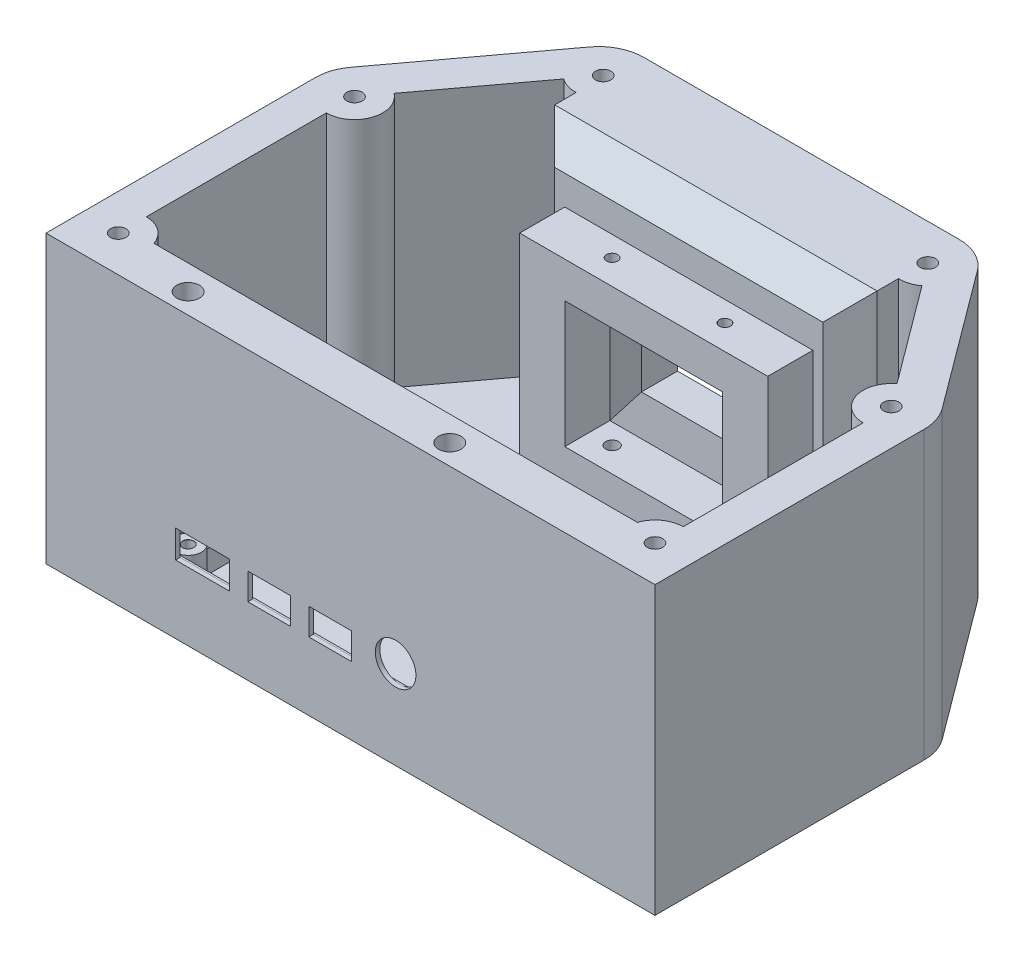
from build123d import *

# Parameters (mm, degrees)
BOSS_EXTRUDE1_DEPTH                                = 7
BOSS_EXTRUDE2_DEPTH                                = 5
SKETCH2_3_R                                        = 3
BOSS_EXTRUDE3_DEPTH                                = 8
F_2_5MM_DOWEL_HOLE1_D                              = 2.5
F_2_5MM_DOWEL_HOLE1_DEPTH                          = 8
F_2_5MM_DOWEL_HOLE1_CSINK_D                        = 2.55
F_2_5MM_DOWEL_HOLE1_CSINK_ANGLE                    = 90
F_2_5MM_DOWEL_HOLE1_TIP                            = 0.751075774
SKETCH2_4_W                                        = 55
SKETCH2_4_H                                        = 10
BOSS_EXTRUDE4_DEPTH                                = 8
SKETCH7_W                                          = 10
SKETCH7_H                                          = 10
BOSS_EXTRUDE5_DEPTH                                = 28
SKETCH9_W                                          = 55
SKETCH9_H                                          = 10
BOSS_EXTRUDE6_DEPTH                                = 8
SKETCH10_W                                         = 12.5
SKETCH10_H                                         = 44
BOSS_EXTRUDE7_DEPTH                                = 8
BOSS_EXTRUDE10_DEPTH                               = 56.5
FILLET8_R                                          = 10
F_2_5MM_DOWEL_HOLE2_D                              = 2.5
F_2_5MM_DOWEL_HOLE2_DEPTH                          = 8
CBORE_FOR_M2_5_HEX_HEAD_MACHINE_SCREW1_D           = 2.9
CBORE_FOR_M2_5_HEX_HEAD_MACHINE_SCREW1_DEPTH       = 15
CBORE_FOR_M2_5_HEX_HEAD_MACHINE_SCREW1_CBORE_D     = 7.28
CBORE_FOR_M2_5_HEX_HEAD_MACHINE_SCREW1_CBORE_DEPTH = 12
BOSS_EXTRUDE11_REACH                               = 166.956
BOSS_EXTRUDE12_DEPTH                               = 20
SKETCH28_W                                         = 119
SKETCH28_H                                         = 10
BOSS_EXTRUDE13_DEPTH                               = 28.5
CUT_EXTRUDE1_REACH                                 = 185.246
SKETCH16_R                                         = 4.5
SKETCH16_W                                         = 11.94
SKETCH16_H                                         = 6.16
SKETCH16_W_2                                       = 9.5
SKETCH16_H_2                                       = 5.9
CHAMFER1_SIZE                                      = 9
CUT_EXTRUDE2_REACH                                 = 169.482
SKETCH29_R                                         = 2.5
BOSS_EXTRUDE16_REACH                               = 169.482
SKETCH30_R                                         = 6.25
SKETCH30_R_2                                       = 4.25
SKETCH50_W                                         = 6
SKETCH50_H                                         = 56.5
SKETCH50_W_2                                       = 55
SKETCH50_H_2                                       = 44
BOSS_EXTRUDE32_DEPTH                               = 17
SKETCH30_6_R                                       = 4.25
CUT_EXTRUDE3_DEPTH                                 = 57.5
CBORE_FOR_M3_HEX_HEAD_MACHINE_SCREW1_D             = 3.4
CBORE_FOR_M3_HEX_HEAD_MACHINE_SCREW1_CBORE_D       = 8.4
CBORE_FOR_M3_HEX_HEAD_MACHINE_SCREW1_CBORE_DEPTH   = 2.3
CHAMFER5_SIZE                                      = 6


with BuildPart() as part:
    # Sketch1 → Boss-Extrude1 (new body)
    with BuildSketch(Plane(origin=(0, 0, 0), x_dir=(1, 0, 0), z_dir=(0, 1, 0))):
        Polygon((-139.809882217, -3.867603768), (-112.309882217, 33.132396232), (-32.309882217, 33.132396232), (-4.809882217, -3.867603768), (-4.809882217, -66.867603768), (-139.809882217, -66.867603768), align=None)
    extrude(amount=BOSS_EXTRUDE1_DEPTH)

    # Sketch2 → Boss-Extrude2 (add)
    with BuildSketch(Plane(origin=(0, 7, 0), x_dir=(1, 0, 0), z_dir=(0, 1, 0))):
        with BuildLine():
            Line((-115.809882217, -13.367603768), (-115.809882217, -62.367603768))
            ThreePointArc((-115.809882217, -62.367603768), (-114.931202561, -60.246283425), (-112.809882217, -59.367603768))
            Line((-112.809882217, -59.367603768), (-112.809882217, -16.367603768))
            ThreePointArc((-112.809882217, -16.367603768), (-114.931202561, -15.488924112), (-115.809882217, -13.367603768))
        make_face()
        with BuildLine():
            Line((-54.809882217, -10.367603768), (-112.809882217, -10.367603768))
            ThreePointArc((-112.809882217, -10.367603768), (-110.688561874, -11.246283425), (-109.809882217, -13.367603768))
            Line((-109.809882217, -13.367603768), (-57.809882217, -13.367603768))
            ThreePointArc((-57.809882217, -13.367603768), (-56.931202561, -11.246283425), (-54.809882217, -10.367603768))
        make_face()
        with BuildLine():
            ThreePointArc((-109.809882217, -62.367603768), (-110.688561874, -64.488924112), (-112.809882217, -65.367603768))
            Line((-112.809882217, -65.367603768), (-54.809882217, -65.367603768))
            ThreePointArc((-54.809882217, -65.367603768), (-56.931202561, -64.488924112), (-57.809882217, -62.367603768))
            Line((-57.809882217, -62.367603768), (-109.809882217, -62.367603768))
        make_face()
        with BuildLine():
            ThreePointArc((-54.809882217, -59.367603768), (-52.688561874, -60.246283425), (-51.809882217, -62.367603768))
            Line((-51.809882217, -62.367603768), (-51.809882217, -13.367603768))
            ThreePointArc((-51.809882217, -13.367603768), (-52.688561874, -15.488924112), (-54.809882217, -16.367603768))
            Line((-54.809882217, -16.367603768), (-54.809882217, -59.367603768))
        make_face()
    extrude(amount=BOSS_EXTRUDE2_DEPTH)

    # Sketch2<3> → Boss-Extrude3 (add)
    with BuildSketch(Plane(origin=(0, 7, 0), x_dir=(1, 0, 0), z_dir=(0, 1, 0))):
        with Locations(Location((-112.809882217, -13.367603768, 0), (0, 0, 270))):
            Circle(SKETCH2_3_R)
        with Locations(Location((-54.809882217, -13.367603768, 0), (0, 0, 270))):
            Circle(SKETCH2_3_R)
        with Locations(Location((-54.809882217, -62.367603768, 0), (0, 0, 270))):
            Circle(SKETCH2_3_R)
        with Locations(Location((-112.809882217, -62.367603768, 0), (0, 0, 270))):
            Circle(SKETCH2_3_R)
    extrude(amount=BOSS_EXTRUDE3_DEPTH)

    # Ø2.5mm Dowel Hole1
    with Locations(Plane(origin=(0, 15, 0), x_dir=(1, 0, 0), z_dir=(0, 1, 0))):
        with Locations((-54.809882217, -13.367603768), (-112.809882217, -13.367603768), (-54.809882217, -62.367603768), (-112.809882217, -62.367603768)):
            CounterSinkHole(F_2_5MM_DOWEL_HOLE1_D / 2, F_2_5MM_DOWEL_HOLE1_CSINK_D / 2, depth=F_2_5MM_DOWEL_HOLE1_DEPTH, counter_sink_angle=F_2_5MM_DOWEL_HOLE1_CSINK_ANGLE)
            with Locations((0, 0, -(F_2_5MM_DOWEL_HOLE1_DEPTH + F_2_5MM_DOWEL_HOLE1_TIP / 2))):  # 118° drill point
                Cone(0, F_2_5MM_DOWEL_HOLE1_D / 2, F_2_5MM_DOWEL_HOLE1_TIP, mode=Mode.SUBTRACT)

    # Sketch2<4> → Boss-Extrude4 (add)
    with BuildSketch(Plane(origin=(0, 7, 0), x_dir=(1, 0, 0), z_dir=(0, 1, 0))):
        with Locations((-72.309882217, 3.132396232)):
            Rectangle(SKETCH2_4_W, SKETCH2_4_H)
    extrude(amount=BOSS_EXTRUDE4_DEPTH)

    # Sketch7 → Boss-Extrude5 (add)
    with BuildSketch(Plane(origin=(0, 15, 0), x_dir=(1, 0, 0), z_dir=(0, 1, 0))):
        with Locations((-94.809882217, 3.132396232)):
            Rectangle(SKETCH7_W, SKETCH7_H)
        with Locations((-49.809882217, 3.132396232)):
            Rectangle(SKETCH7_W, SKETCH7_H)
    extrude(amount=BOSS_EXTRUDE5_DEPTH)

    # Sketch9 → Boss-Extrude6 (add)
    with BuildSketch(Plane(origin=(0, 43, 0), x_dir=(1, 0, 0), z_dir=(0, 1, 0))):
        with Locations((-72.309882217, 3.132396232)):
            Rectangle(SKETCH9_W, SKETCH9_H)
    extrude(amount=BOSS_EXTRUDE6_DEPTH)

    # Sketch10 → Boss-Extrude7 (add)
    with BuildSketch(Plane(origin=(0, 0, -33.132396232), x_dir=(-1, 0, 0), z_dir=(0, 0, -1))):
        with Locations((38.559882217, 29)):
            Rectangle(SKETCH10_W, SKETCH10_H)
        Polygon((32.309882217, 63.5), (32.309882217, 51), (44.809882217, 51), (99.809882217, 51), (112.309882217, 51), (112.309882217, 63.5), align=None)
        with Locations((106.059882217, 29)):
            Rectangle(SKETCH10_W, SKETCH10_H)
    extrude(amount=-BOSS_EXTRUDE7_DEPTH)

    # Sketch11 → Boss-Extrude10 (add)
    with BuildSketch(Plane(origin=(0, 7, 0), x_dir=(1, 0, 0), z_dir=(0, 1, 0))):
        Polygon((-139.809882217, -66.867603768), (-131.809882217, -66.867603768), (-131.809882217, -65.367603768), (-131.809882217, -58.867603768), (-131.809882217, -6.515002703), (-108.288166793, 25.132396232), (-112.309882217, 25.132396232), (-112.309882217, 33.132396232), (-139.809882217, -3.867603768), align=None)
        Polygon((-4.809882217, -66.867603768), (-12.809882217, -66.867603768), (-12.809882217, -6.515002703), (-36.331597642, 25.132396232), (-36.331597642, 33.132396232), (-32.309882217, 33.132396232), (-4.809882217, -3.867603768), align=None)
    extrude(amount=BOSS_EXTRUDE10_DEPTH)

    # Fillet8
    fillet8_edges = [part.edges().sort_by_distance(p)[0] for p in [
        (-139.809882217, 31.75, 3.867603768),
        (-112.309882217, 31.75, -33.132396232),
        (-32.309882217, 31.75, -33.132396232),
        (-4.809882217, 31.75, 3.867603768),
    ]]
    fillet(fillet8_edges, radius=FILLET8_R)

    # Ø2.5mm Dowel Hole2
    with Locations(Plane(origin=(0, 51, 0), x_dir=(1, 0, 0), z_dir=(0, 1, 0))):
        with Locations((-84.809882217, 3.632396232), (-59.809882217, 3.632396232)):
            Hole(F_2_5MM_DOWEL_HOLE2_D / 2, depth=F_2_5MM_DOWEL_HOLE2_DEPTH)

    # CBORE for M2.5 Hex Head Machine Screw1
    with Locations(Plane(origin=(0, 0, 0), x_dir=(-1, 0, 0), z_dir=(0, -1, 0))):
        with Locations((59.809882217, 3.632396232), (84.809882217, 3.632396232)):
            CounterBoreHole(CBORE_FOR_M2_5_HEX_HEAD_MACHINE_SCREW1_D / 2, CBORE_FOR_M2_5_HEX_HEAD_MACHINE_SCREW1_CBORE_D / 2, CBORE_FOR_M2_5_HEX_HEAD_MACHINE_SCREW1_CBORE_DEPTH, depth=CBORE_FOR_M2_5_HEX_HEAD_MACHINE_SCREW1_DEPTH)

    # Boss-Extrude11: up to this face of the body (flat: up to its plane)
    boss_extrude11_end = Plane(part.part.faces().sort_by_distance((-112.809882217, 15, 59.452456582))[0])
    # Sketch26 → Boss-Extrude11 (add, up to the picked face)
    with BuildSketch(Plane(origin=(0, 7, 0), x_dir=(1, 0, 0), z_dir=(0, 1, 0)), mode=Mode.PRIVATE) as boss_extrude11_sk1:
        Polygon((-115.809882217, -58.867603768), (-131.809882217, -58.867603768), (-131.809882217, -66.867603768), (-12.809882217, -66.867603768), (-12.809882217, -58.867603768), (-51.809882217, -58.867603768), (-51.809882217, -62.367603768), (-54.809882217, -65.367603768), (-112.809882217, -65.367603768), (-115.809882217, -62.367603768), align=None)
    boss_extrude11_tool1 = split(extrude(boss_extrude11_sk1.sketch, amount=BOSS_EXTRUDE11_REACH, mode=Mode.PRIVATE), bisect_by=boss_extrude11_end, keep=Keep.BOTH, mode=Mode.PRIVATE)
    add(boss_extrude11_tool1.solids().sort_by(Axis((-123.809882, 7, 60.06029), (0, 1, 0)))[0])

    # Sketch27 → Boss-Extrude12 (add)
    with BuildSketch(Plane(origin=(0, 15, 0), x_dir=(1, 0, 0), z_dir=(0, 1, 0))):
        Polygon((-118.309882217, -58.867603768), (-118.309882217, -65.867603768), (-12.809882217, -65.867603768), (-12.809882217, -66.867603768), (-131.809882217, -66.867603768), (-131.809882217, -58.867603768), align=None)
    extrude(amount=BOSS_EXTRUDE12_DEPTH)

    # Sketch28 → Boss-Extrude13 (add)
    with BuildSketch(Plane(origin=(0, 35, 0), x_dir=(1, 0, 0), z_dir=(0, 1, 0))):
        with Locations((-72.309882217, -61.867603768)):
            Rectangle(SKETCH28_W, SKETCH28_H)
    extrude(amount=BOSS_EXTRUDE13_DEPTH)

    # Sketch16 → Cut-Extrude1 (cut, up to next)
    with BuildSketch(Plane.XY.offset(66.867603768), mode=Mode.PRIVATE) as cut_extrude1_sk1:
        with Locations((-62.309882217, 19.59)):
            Circle(SKETCH16_R)
    cut_extrude1_tool1 = extrude(cut_extrude1_sk1.sketch, amount=-CUT_EXTRUDE1_REACH, mode=Mode.PRIVATE) & part.part
    # Sketch16 → Cut-Extrude1 (cut, up to next)
    with BuildSketch(Plane.XY.offset(66.867603768), mode=Mode.PRIVATE) as cut_extrude1_sk2:
        with Locations((-105.109882217, 18.17)):
            Rectangle(SKETCH16_W, SKETCH16_H)
    cut_extrude1_tool2 = extrude(cut_extrude1_sk2.sketch, amount=-CUT_EXTRUDE1_REACH, mode=Mode.PRIVATE) & part.part
    # Sketch16 → Cut-Extrude1 (cut, up to next)
    with BuildSketch(Plane.XY.offset(66.867603768), mode=Mode.PRIVATE) as cut_extrude1_sk3:
        with Locations((-90.309882217, 18.04)):
            Rectangle(SKETCH16_W_2, SKETCH16_H_2)
    cut_extrude1_tool3 = extrude(cut_extrude1_sk3.sketch, amount=-CUT_EXTRUDE1_REACH, mode=Mode.PRIVATE) & part.part
    # Sketch16 → Cut-Extrude1 (cut, up to next)
    with BuildSketch(Plane.XY.offset(66.867603768), mode=Mode.PRIVATE) as cut_extrude1_sk4:
        with Locations((-76.809882217, 18.04)):
            Rectangle(SKETCH16_W_2, SKETCH16_H_2)
    cut_extrude1_tool4 = extrude(cut_extrude1_sk4.sketch, amount=-CUT_EXTRUDE1_REACH, mode=Mode.PRIVATE) & part.part
    add(cut_extrude1_tool1.solids().sort_by_distance((-62.309882, 19.59, 66.867604))[0], mode=Mode.SUBTRACT)
    add(cut_extrude1_tool2.solids().sort_by_distance((-105.109882, 18.17, 66.867604))[0], mode=Mode.SUBTRACT)
    add(cut_extrude1_tool3.solids().sort_by_distance((-90.309882, 18.04, 66.867604))[0], mode=Mode.SUBTRACT)
    add(cut_extrude1_tool4.solids().sort_by_distance((-76.809882, 18.04, 66.867604))[0], mode=Mode.SUBTRACT)

    # Chamfer1
    chamfer1_edges = [part.edges().sort_by_distance(p)[0] for p in [
        (-72.309882217, 35, 56.867603768),
    ]]
    chamfer(chamfer1_edges, length=CHAMFER1_SIZE - 0.0001)  # a hair under: the kernel refuses the full size

    # Sketch29 → Cut-Extrude2 (cut, up to next)
    with BuildSketch(Plane(origin=(0, 63.5, 0), x_dir=(1, 0, 0), z_dir=(0, 1, 0)), mode=Mode.PRIVATE) as cut_extrude2_sk1:
        with Locations(Location((-112.809882217, -62.367603768, 0), (0, 0, 270))):
            Circle(SKETCH29_R)
    cut_extrude2_tool1 = extrude(cut_extrude2_sk1.sketch, amount=-CUT_EXTRUDE2_REACH, mode=Mode.PRIVATE) & part.part
    # Sketch29 → Cut-Extrude2 (cut, up to next)
    with BuildSketch(Plane(origin=(0, 63.5, 0), x_dir=(1, 0, 0), z_dir=(0, 1, 0)), mode=Mode.PRIVATE) as cut_extrude2_sk2:
        with Locations(Location((-54.809882217, -62.367603768, 0), (0, 0, 270))):
            Circle(SKETCH29_R)
    cut_extrude2_tool2 = extrude(cut_extrude2_sk2.sketch, amount=-CUT_EXTRUDE2_REACH, mode=Mode.PRIVATE) & part.part
    add(cut_extrude2_tool1.solids().sort_by_distance((-112.809882, 63.5, 62.367604))[0], mode=Mode.SUBTRACT)
    add(cut_extrude2_tool2.solids().sort_by_distance((-54.809882, 63.5, 62.367604))[0], mode=Mode.SUBTRACT)

    # Boss-Extrude16: up to this face of the body (flat: up to its plane)
    boss_extrude16_end = Plane(part.part.faces().sort_by_distance((-72.309882217, 63.5, -31.45236647))[0])
    # Sketch30 → Boss-Extrude16 (add, up to the picked face)
    with BuildSketch(Plane.XZ, mode=Mode.PRIVATE) as boss_extrude16_sk1:
        with Locations((-131.809882217, 58.867603768)):
            Circle(SKETCH30_R)
        with Locations((-131.809882217, 58.867603768)):
            Circle(SKETCH30_R_2, mode=Mode.SUBTRACT)
    boss_extrude16_tool1 = split(extrude(boss_extrude16_sk1.sketch, amount=-BOSS_EXTRUDE16_REACH, mode=Mode.PRIVATE), bisect_by=boss_extrude16_end, keep=Keep.BOTH, mode=Mode.PRIVATE)
    # Sketch30 → Boss-Extrude16 (add, up to the picked face)
    with BuildSketch(Plane.XZ, mode=Mode.PRIVATE) as boss_extrude16_sk2:
        with Locations((-131.809882217, 58.867603768)):
            Circle(SKETCH30_R_2)
    boss_extrude16_tool2 = split(extrude(boss_extrude16_sk2.sketch, amount=-BOSS_EXTRUDE16_REACH, mode=Mode.PRIVATE), bisect_by=boss_extrude16_end, keep=Keep.BOTH, mode=Mode.PRIVATE)
    # Sketch30 → Boss-Extrude16 (add, up to the picked face)
    with BuildSketch(Plane.XZ, mode=Mode.PRIVATE) as boss_extrude16_sk3:
        with Locations((-131.809882217, 6.473542023)):
            Circle(SKETCH30_R)
        with Locations((-131.809882217, 6.473542023)):
            Circle(SKETCH30_R_2, mode=Mode.SUBTRACT)
    boss_extrude16_tool3 = split(extrude(boss_extrude16_sk3.sketch, amount=-BOSS_EXTRUDE16_REACH, mode=Mode.PRIVATE), bisect_by=boss_extrude16_end, keep=Keep.BOTH, mode=Mode.PRIVATE)
    # Sketch30 → Boss-Extrude16 (add, up to the picked face)
    with BuildSketch(Plane.XZ, mode=Mode.PRIVATE) as boss_extrude16_sk4:
        with Locations((-131.809882217, 6.473542023)):
            Circle(SKETCH30_R_2)
    boss_extrude16_tool4 = split(extrude(boss_extrude16_sk4.sketch, amount=-BOSS_EXTRUDE16_REACH, mode=Mode.PRIVATE), bisect_by=boss_extrude16_end, keep=Keep.BOTH, mode=Mode.PRIVATE)
    # Sketch30 → Boss-Extrude16 (add, up to the picked face)
    with BuildSketch(Plane.XZ, mode=Mode.PRIVATE) as boss_extrude16_sk5:
        with Locations((-108.288166793, -25.132396232)):
            Circle(SKETCH30_R)
        with Locations((-108.288166793, -25.132396232)):
            Circle(SKETCH30_R_2, mode=Mode.SUBTRACT)
    boss_extrude16_tool5 = split(extrude(boss_extrude16_sk5.sketch, amount=-BOSS_EXTRUDE16_REACH, mode=Mode.PRIVATE), bisect_by=boss_extrude16_end, keep=Keep.BOTH, mode=Mode.PRIVATE)
    # Sketch30 → Boss-Extrude16 (add, up to the picked face)
    with BuildSketch(Plane.XZ, mode=Mode.PRIVATE) as boss_extrude16_sk6:
        with Locations((-108.288166793, -25.132396232)):
            Circle(SKETCH30_R_2)
    boss_extrude16_tool6 = split(extrude(boss_extrude16_sk6.sketch, amount=-BOSS_EXTRUDE16_REACH, mode=Mode.PRIVATE), bisect_by=boss_extrude16_end, keep=Keep.BOTH, mode=Mode.PRIVATE)
    # Sketch30 → Boss-Extrude16 (add, up to the picked face)
    with BuildSketch(Plane.XZ, mode=Mode.PRIVATE) as boss_extrude16_sk7:
        with Locations((-12.809882217, 58.867603768)):
            Circle(SKETCH30_R)
        with Locations((-12.809882217, 58.867603768)):
            Circle(SKETCH30_R_2, mode=Mode.SUBTRACT)
    boss_extrude16_tool7 = split(extrude(boss_extrude16_sk7.sketch, amount=-BOSS_EXTRUDE16_REACH, mode=Mode.PRIVATE), bisect_by=boss_extrude16_end, keep=Keep.BOTH, mode=Mode.PRIVATE)
    # Sketch30 → Boss-Extrude16 (add, up to the picked face)
    with BuildSketch(Plane.XZ, mode=Mode.PRIVATE) as boss_extrude16_sk8:
        with Locations((-12.809882217, 58.867603768)):
            Circle(SKETCH30_R_2)
    boss_extrude16_tool8 = split(extrude(boss_extrude16_sk8.sketch, amount=-BOSS_EXTRUDE16_REACH, mode=Mode.PRIVATE), bisect_by=boss_extrude16_end, keep=Keep.BOTH, mode=Mode.PRIVATE)
    # Sketch30 → Boss-Extrude16 (add, up to the picked face)
    with BuildSketch(Plane.XZ, mode=Mode.PRIVATE) as boss_extrude16_sk9:
        with Locations((-12.809882217, 6.473542023)):
            Circle(SKETCH30_R)
        with Locations((-12.809882217, 6.473542023)):
            Circle(SKETCH30_R_2, mode=Mode.SUBTRACT)
    boss_extrude16_tool9 = split(extrude(boss_extrude16_sk9.sketch, amount=-BOSS_EXTRUDE16_REACH, mode=Mode.PRIVATE), bisect_by=boss_extrude16_end, keep=Keep.BOTH, mode=Mode.PRIVATE)
    # Sketch30 → Boss-Extrude16 (add, up to the picked face)
    with BuildSketch(Plane.XZ, mode=Mode.PRIVATE) as boss_extrude16_sk10:
        with Locations((-12.809882217, 6.473542023)):
            Circle(SKETCH30_R_2)
    boss_extrude16_tool10 = split(extrude(boss_extrude16_sk10.sketch, amount=-BOSS_EXTRUDE16_REACH, mode=Mode.PRIVATE), bisect_by=boss_extrude16_end, keep=Keep.BOTH, mode=Mode.PRIVATE)
    # Sketch30 → Boss-Extrude16 (add, up to the picked face)
    with BuildSketch(Plane.XZ, mode=Mode.PRIVATE) as boss_extrude16_sk11:
        with Locations((-36.331597642, -25.132396232)):
            Circle(SKETCH30_R)
        with Locations((-36.331597642, -25.132396232)):
            Circle(SKETCH30_R_2, mode=Mode.SUBTRACT)
    boss_extrude16_tool11 = split(extrude(boss_extrude16_sk11.sketch, amount=-BOSS_EXTRUDE16_REACH, mode=Mode.PRIVATE), bisect_by=boss_extrude16_end, keep=Keep.BOTH, mode=Mode.PRIVATE)
    # Sketch30 → Boss-Extrude16 (add, up to the picked face)
    with BuildSketch(Plane.XZ, mode=Mode.PRIVATE) as boss_extrude16_sk12:
        with Locations((-36.331597642, -25.132396232)):
            Circle(SKETCH30_R_2)
    boss_extrude16_tool12 = split(extrude(boss_extrude16_sk12.sketch, amount=-BOSS_EXTRUDE16_REACH, mode=Mode.PRIVATE), bisect_by=boss_extrude16_end, keep=Keep.BOTH, mode=Mode.PRIVATE)
    add(boss_extrude16_tool1.solids().sort_by(Axis((-137.883106, 0, 58.867604), (0, 1, 0)))[0])
    add(boss_extrude16_tool2.solids().sort_by(Axis((-131.809882, 0, 58.867604), (0, 1, 0)))[0])
    add(boss_extrude16_tool3.solids().sort_by(Axis((-137.883106, 0, 6.473542), (0, 1, 0)))[0])
    add(boss_extrude16_tool4.solids().sort_by(Axis((-131.809882, 0, 6.473542), (0, 1, 0)))[0])
    add(boss_extrude16_tool5.solids().sort_by(Axis((-114.36139, 0, -25.132396), (0, 1, 0)))[0])
    add(boss_extrude16_tool6.solids().sort_by(Axis((-108.288167, 0, -25.132396), (0, 1, 0)))[0])
    add(boss_extrude16_tool7.solids().sort_by(Axis((-18.883106, 0, 58.867604), (0, 1, 0)))[0])
    add(boss_extrude16_tool8.solids().sort_by(Axis((-12.809882, 0, 58.867604), (0, 1, 0)))[0])
    add(boss_extrude16_tool9.solids().sort_by(Axis((-18.883106, 0, 6.473542), (0, 1, 0)))[0])
    add(boss_extrude16_tool10.solids().sort_by(Axis((-12.809882, 0, 6.473542), (0, 1, 0)))[0])
    add(boss_extrude16_tool11.solids().sort_by(Axis((-42.404821, 0, -25.132396), (0, 1, 0)))[0])
    add(boss_extrude16_tool12.solids().sort_by(Axis((-36.331598, 0, -25.132396), (0, 1, 0)))[0])

    # Sketch50 → Boss-Extrude32 (add)
    with BuildSketch(Plane.XY.offset(-25.132396232)):
        with Locations((-105.038166793, 35.25)):
            Rectangle(SKETCH50_W, SKETCH50_H)
        Polygon((-44.809882217, 7), (-42.581597642, 7), (-42.581597642, 63.5), (-102.038166793, 63.5), (-102.038166793, 7), (-99.809882217, 7), (-99.809882217, 51), (-44.809882217, 51), align=None)
        with Locations((-39.581597642, 35.25)):
            Rectangle(SKETCH50_W, SKETCH50_H)
        with Locations((-72.309882217, 29)):
            Rectangle(SKETCH50_W_2, SKETCH50_H_2)
    extrude(amount=BOSS_EXTRUDE32_DEPTH)

    # Sketch30<6> → Cut-Extrude3 (cut)
    with BuildSketch(Plane.XZ):
        with Locations(Location((-12.809882217, 58.867603768, 0), (0, 0, 270))):
            Circle(SKETCH30_6_R)
        with Locations(Location((-131.809882217, 58.867603768, 0), (0, 0, 270))):
            Circle(SKETCH30_6_R)
        with Locations(Location((-131.809882217, 6.473542023, 0), (0, 0, 270))):
            Circle(SKETCH30_6_R)
        with Locations(Location((-108.288166793, -25.132396232, 0), (0, 0, 270))):
            Circle(SKETCH30_6_R)
        with Locations(Location((-12.809882217, 6.473542023, 0), (0, 0, 270))):
            Circle(SKETCH30_6_R)
        with Locations(Location((-36.331597642, -25.132396232, 0), (0, 0, 270))):
            Circle(SKETCH30_6_R)
    extrude(amount=-CUT_EXTRUDE3_DEPTH, mode=Mode.SUBTRACT)

    # CBORE for M3 Hex Head Machine Screw1 (through all)
    with Locations(Plane(origin=(0, 57.5, 0), x_dir=(-1, 0, 0), z_dir=(0, -1, 0))):
        with Locations((12.809882217, -58.867603768), (12.809882217, -6.473542023), (36.331597642, 25.132396232), (131.809882217, -58.867603768), (131.809882217, -6.473542023), (108.288166793, 25.132396232)):
            CounterBoreHole(CBORE_FOR_M3_HEX_HEAD_MACHINE_SCREW1_D / 2, CBORE_FOR_M3_HEX_HEAD_MACHINE_SCREW1_CBORE_D / 2, CBORE_FOR_M3_HEX_HEAD_MACHINE_SCREW1_CBORE_DEPTH)

    # Chamfer5
    chamfer5_edges = [part.edges().sort_by_distance(p)[0] for p in [
        (-72.309882217, 63.5, -8.132396232),
        (-108.038166793, 35.25, -8.132396232),
        (-36.581597642, 35.25, -8.132396232),
    ]]
    chamfer(chamfer5_edges, length=CHAMFER5_SIZE)

    # Sketch58 → Cut-Loft20 section 0
    with BuildSketch(Plane(origin=(0, 0, -25.132396232), x_dir=(-1, 0, 0), z_dir=(0, 0, -1))):
        with BuildLine():
            Line((44.809882217, 51), (99.809882217, 51))
            Line((99.809882217, 51), (99.809882217, 7))
            Line((99.809882217, 7), (44.809882217, 7))
            Line((44.809882217, 7), (44.809882217, 51))
        make_face()
    # Sketch59 → Cut-Loft20 section 1
    with BuildSketch(Plane.XY.offset(-8.132396232)):
        with BuildLine():
            Line((-54.809882217, 15), (-89.809882217, 15))
            Line((-89.809882217, 15), (-89.809882217, 43))
            Line((-89.809882217, 43), (-54.809882217, 43))
            Line((-54.809882217, 43), (-54.809882217, 15))
        make_face()
    loft(mode=Mode.SUBTRACT)


solid = part.part
